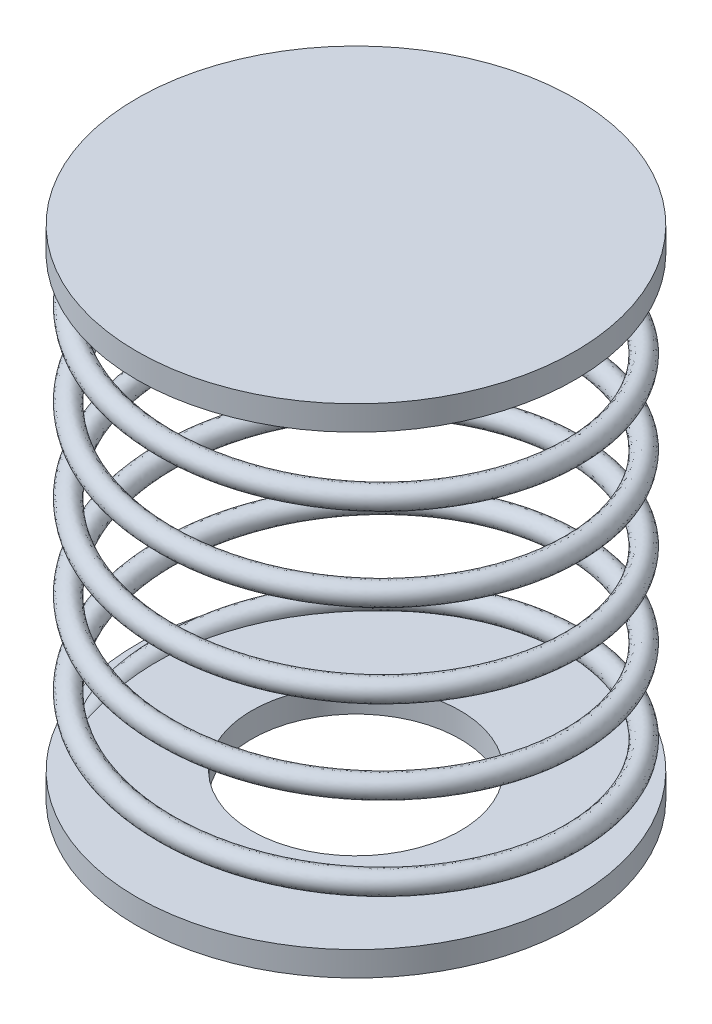
from build123d import *

# Parameters (mm, degrees)
SWEEP1_PITCH        = 5.08
SWEEP1_HEIGHT       = 30.3
SWEEP1_RADIUS       = 12.4
SKETCH4_R           = 0.635
SKETCH11_R          = 13.35
BOSS_EXTRUDE3_DEPTH = 1.5
BOSS_EXTRUDE6_START = 1.5
SKETCH12_R          = 13.35
SKETCH12_R_2        = 6.35
BOSS_EXTRUDE6_DEPTH = 1.5
SURFACECUT1_START   = 30.300356458
SURFACECUT1_DEPTH   = 1.699643542


with BuildPart() as part:
    # Sweep1: sweep along a helix
    with BuildLine() as sweep1_path:
        Helix(SWEEP1_PITCH, SWEEP1_HEIGHT, SWEEP1_RADIUS, center=(0, 0, 0), direction=(0, 1, 0), lefthand=True)
    # Sketch4 → Sweep1 (sweep)
    with BuildSketch(Plane(origin=(0, 0, 0), x_dir=(0, 0, -1), z_dir=(1, 0, 0))):
        with Locations((-12.4, 0)):
            Circle(SKETCH4_R)
    sweep(path=sweep1_path.line, is_frenet=True)

    # Sketch11 → Boss-Extrude3 (add)
    with BuildSketch(Plane(origin=(0, 30.300356458, 0), x_dir=(1, 0, 0), z_dir=(0, 1, 0))):
        with Locations(Location((0, 0, 0), (0, 0, 270))):
            Circle(SKETCH11_R)
    extrude(amount=-BOSS_EXTRUDE3_DEPTH)

    # Sketch12 → Boss-Extrude6 (add)
    with BuildSketch(Plane(origin=(0, 0, 0), x_dir=(1, 0, 0), z_dir=(0, 1, 0)).offset(BOSS_EXTRUDE6_START)):
        with Locations(Location((0, 0, 0), (0, 0, 270))):
            Circle(SKETCH12_R)
        with Locations(Location((0, 0, 0), (0, 0, 270))):
            Circle(SKETCH12_R_2, mode=Mode.SUBTRACT)
    extrude(amount=-BOSS_EXTRUDE6_DEPTH)

    # SurfaceCut1: read off the stored shape, not the designer's step
    # SurfaceCut1 outline → SurfaceCut1 (cut)
    with BuildSketch(Plane(origin=(0, 0, 0), x_dir=(1, 0, 0), z_dir=(0, 1, 0)).offset(SURFACECUT1_START)):
        Polygon((1.131926245, -5), (2.597688035, -11.474634716), (2.878101448, -12.713290568), (3.169393483, -14), (12, -14), (12, -5), align=None)
    extrude(amount=SURFACECUT1_DEPTH, mode=Mode.SUBTRACT)

    # SurfaceCut2
    split(bisect_by=Plane(origin=(0, 0, 0), x_dir=(1, 0, 0), z_dir=(0, 1, 0)), keep=Keep.TOP)


solid = part.part
